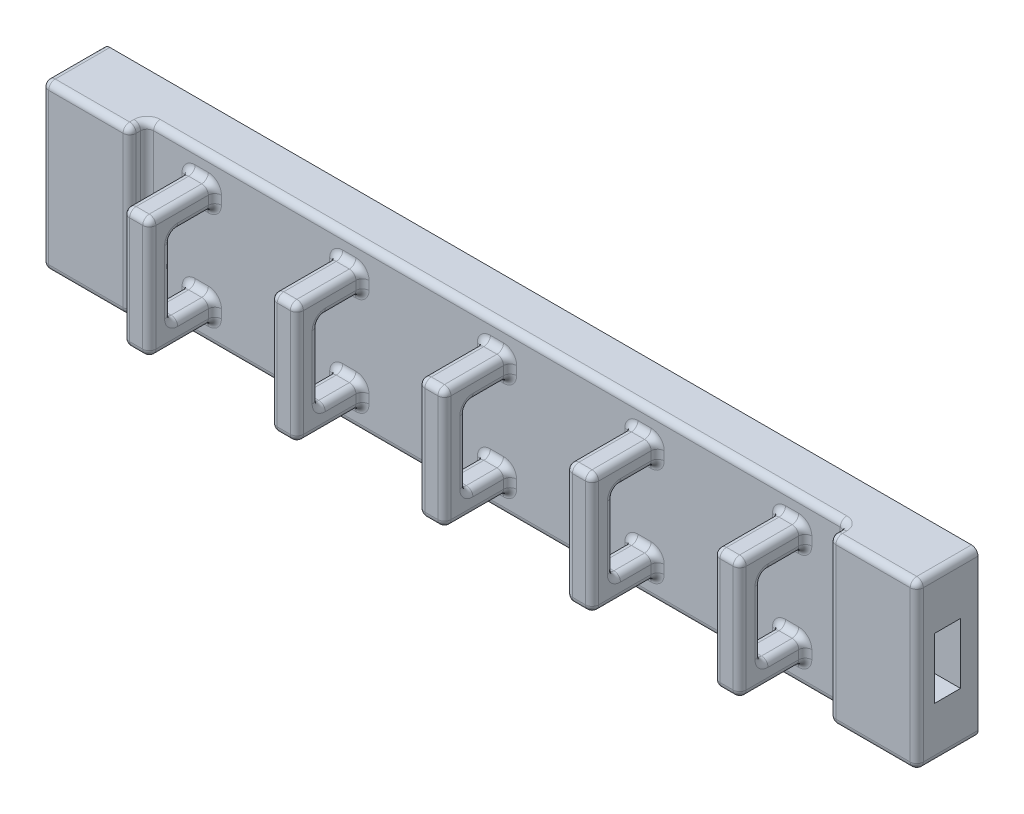
from build123d import *

# Parameters (mm, degrees)
SKETCH2_W              = 101.6
SKETCH2_H              = 19.05
BOSS_EXTRUDE1_DEPTH    = 5.08
M3_CLEARANCE_HOLE1_D   = 3.6
BOSS_EXTRUDE3_DEPTH    = 1.524
FILLET2_R              = 0.762
LPATTERN2_COUNT        = 5
LPATTERN2_PITCH        = 17.145
FILLET2_OF_LPATTERN2_R = 0.762
CUT_EXTRUDE1_DEPTH     = 3.048
SKETCH8_W              = 10.16
SKETCH8_H              = 19.05
BOSS_EXTRUDE4_DEPTH    = 2.032
FILLET3_R              = 0.762


with BuildPart() as part:
    # Sketch2 → Boss-Extrude1 (new body)
    with BuildSketch(Plane.XY):
        with Locations((50.8, 9.525)):
            Rectangle(SKETCH2_W, SKETCH2_H)
    extrude(amount=BOSS_EXTRUDE1_DEPTH)

    # M3 Clearance Hole1 (through all)
    with Locations(Plane.XY.offset(5.08)):
        with Locations((5.08, 9.525), (96.52, 9.525)):
            Hole(M3_CLEARANCE_HOLE1_D / 2)

    # Sketch6 → Boss-Extrude3 (add, symmetric)
    with BuildSketch(Plane.ZY.offset(-16.51)):
        Polygon((5.08, 16.51), (12.7, 16.51), (12.7, 2.54), (5.08, 2.54), (5.08, 5.08), (10.16, 5.08), (10.16, 13.97), (5.08, 13.97), align=None)
    boss_extrude3 = extrude(amount=BOSS_EXTRUDE3_DEPTH, both=True)

    # Fillet2
    fillet2_edges = [part.edges().sort_by_distance(p)[0] for p in [
        (16.51, 16.51, 5.08),
        (16.51, 2.54, 5.08),
        (16.51, 5.08, 5.08),
        (16.51, 13.97, 5.08),
        (16.51, 13.97, 10.16),
        (16.51, 5.08, 10.16),
        (18.034, 13.97, 7.62),
        (18.034, 9.525, 10.16),
        (18.034, 5.08, 7.62),
        (18.034, 3.81, 5.08),
        (18.034, 2.54, 8.89),
        (18.034, 9.525, 12.7),
        (18.034, 16.51, 8.89),
        (18.034, 15.24, 5.08),
        (14.986, 16.51, 8.89),
        (14.986, 9.525, 12.7),
        (14.986, 2.54, 8.89),
        (14.986, 3.81, 5.08),
        (14.986, 5.08, 7.62),
        (14.986, 9.525, 10.16),
        (14.986, 13.97, 7.62),
        (14.986, 15.24, 5.08),
        (16.51, 2.54, 12.7),
        (16.51, 16.51, 12.7),
    ]]
    fillet(fillet2_edges, radius=FILLET2_R)

    # LPattern2: Boss-Extrude3 ×5
    with Locations(*[(i * LPATTERN2_PITCH, 0, 0) for i in range(1, LPATTERN2_COUNT)]):
        add(boss_extrude3)

    # Fillet2 of LPattern2
    fillet2_of_lpattern2_edges = [part.edges().sort_by_distance(p)[0] for p in [
        (33.655, 16.51, 5.08),
        (33.655, 2.54, 5.08),
        (33.655, 5.08, 5.08),
        (33.655, 13.97, 5.08),
        (33.655, 13.97, 10.16),
        (33.655, 5.08, 10.16),
        (35.179, 13.97, 7.62),
        (35.179, 9.525, 10.16),
        (35.179, 5.08, 7.62),
        (35.179, 3.81, 5.08),
        (35.179, 2.54, 8.89),
        (35.179, 9.525, 12.7),
        (35.179, 16.51, 8.89),
        (35.179, 15.24, 5.08),
        (32.131, 16.51, 8.89),
        (32.131, 9.525, 12.7),
        (32.131, 2.54, 8.89),
        (32.131, 3.81, 5.08),
        (32.131, 5.08, 7.62),
        (32.131, 9.525, 10.16),
        (32.131, 13.97, 7.62),
        (32.131, 15.24, 5.08),
        (33.655, 2.54, 12.7),
        (33.655, 16.51, 12.7),
        (50.8, 16.51, 5.08),
        (50.8, 2.54, 5.08),
        (50.8, 5.08, 5.08),
        (50.8, 13.97, 5.08),
        (50.8, 13.97, 10.16),
        (50.8, 5.08, 10.16),
        (52.324, 13.97, 7.62),
        (52.324, 9.525, 10.16),
        (52.324, 5.08, 7.62),
        (52.324, 3.81, 5.08),
        (52.324, 2.54, 8.89),
        (52.324, 9.525, 12.7),
        (52.324, 16.51, 8.89),
        (52.324, 15.24, 5.08),
        (49.276, 16.51, 8.89),
        (49.276, 9.525, 12.7),
        (49.276, 2.54, 8.89),
        (49.276, 3.81, 5.08),
        (49.276, 5.08, 7.62),
        (49.276, 9.525, 10.16),
        (49.276, 13.97, 7.62),
        (49.276, 15.24, 5.08),
        (50.8, 2.54, 12.7),
        (50.8, 16.51, 12.7),
        (67.945, 16.51, 5.08),
        (67.945, 2.54, 5.08),
        (67.945, 5.08, 5.08),
        (67.945, 13.97, 5.08),
        (67.945, 13.97, 10.16),
        (67.945, 5.08, 10.16),
        (69.469, 13.97, 7.62),
        (69.469, 9.525, 10.16),
        (69.469, 5.08, 7.62),
        (69.469, 3.81, 5.08),
        (69.469, 2.54, 8.89),
        (69.469, 9.525, 12.7),
        (69.469, 16.51, 8.89),
        (69.469, 15.24, 5.08),
        (66.421, 16.51, 8.89),
        (66.421, 9.525, 12.7),
        (66.421, 2.54, 8.89),
        (66.421, 3.81, 5.08),
        (66.421, 5.08, 7.62),
        (66.421, 9.525, 10.16),
        (66.421, 13.97, 7.62),
        (66.421, 15.24, 5.08),
        (67.945, 2.54, 12.7),
        (67.945, 16.51, 12.7),
        (85.09, 16.51, 5.08),
        (85.09, 2.54, 5.08),
        (85.09, 5.08, 5.08),
        (85.09, 13.97, 5.08),
        (85.09, 13.97, 10.16),
        (85.09, 5.08, 10.16),
        (86.614, 13.97, 7.62),
        (86.614, 9.525, 10.16),
        (86.614, 5.08, 7.62),
        (86.614, 3.81, 5.08),
        (86.614, 2.54, 8.89),
        (86.614, 9.525, 12.7),
        (86.614, 16.51, 8.89),
        (86.614, 15.24, 5.08),
        (83.566, 16.51, 8.89),
        (83.566, 9.525, 12.7),
        (83.566, 2.54, 8.89),
        (83.566, 3.81, 5.08),
        (83.566, 5.08, 7.62),
        (83.566, 9.525, 10.16),
        (83.566, 13.97, 7.62),
        (83.566, 15.24, 5.08),
        (85.09, 2.54, 12.7),
        (85.09, 16.51, 12.7),
    ]]
    fillet(fillet2_of_lpattern2_edges, radius=FILLET2_OF_LPATTERN2_R)

    # Sketch7 → Cut-Extrude1 (cut)
    with BuildSketch(Plane(origin=(0, 0, 5.08), x_dir=(-1, 0, 0), z_dir=(0, 0, -1))):
        Polygon((-96.52, 6.005472759), (-93.472, 7.76523638), (-93.472, 11.28476362), (-96.52, 13.044527241), (-101.6, 13.044527241), (-101.6, 6.005472759), align=None)
        Polygon((-8.128, 7.76523638), (-5.08, 6.005472759), (0, 6.005472759), (0, 13.044527241), (-5.08, 13.044527241), (-8.128, 11.28476362), align=None)
    extrude(amount=CUT_EXTRUDE1_DEPTH, mode=Mode.SUBTRACT)

    # Sketch8 → Boss-Extrude4 (add)
    with BuildSketch(Plane.XY.offset(5.08)):
        with Locations((5.08, 9.525)):
            Rectangle(SKETCH8_W, SKETCH8_H)
        with Locations((96.52, 9.525)):
            Rectangle(SKETCH8_W, SKETCH8_H)
    extrude(amount=BOSS_EXTRUDE4_DEPTH)

    # Fillet3
    fillet3_edges = [part.edges().sort_by_distance(p)[0] for p in [
        (50.8, 0, 5.08),
        (50.8, 19.05, 5.08),
        (10.16, 0, 6.096),
        (91.44, 0, 6.096),
        (10.16, 19.05, 6.096),
        (91.44, 19.05, 6.096),
        (5.08, 19.05, 7.112),
        (10.16, 9.525, 7.112),
        (5.08, 0, 7.112),
        (0, 9.525, 7.112),
        (96.52, 0, 7.112),
        (91.44, 9.525, 7.112),
        (96.52, 19.05, 7.112),
        (101.6, 9.525, 7.112),
        (10.16, 9.525, 5.08),
        (91.44, 9.525, 5.08),
        (0, 0, 3.556),
        (0, 19.05, 3.556),
        (101.6, 0, 3.556),
        (101.6, 19.05, 3.556),
    ]]
    fillet(fillet3_edges, radius=FILLET3_R)


solid = part.part
